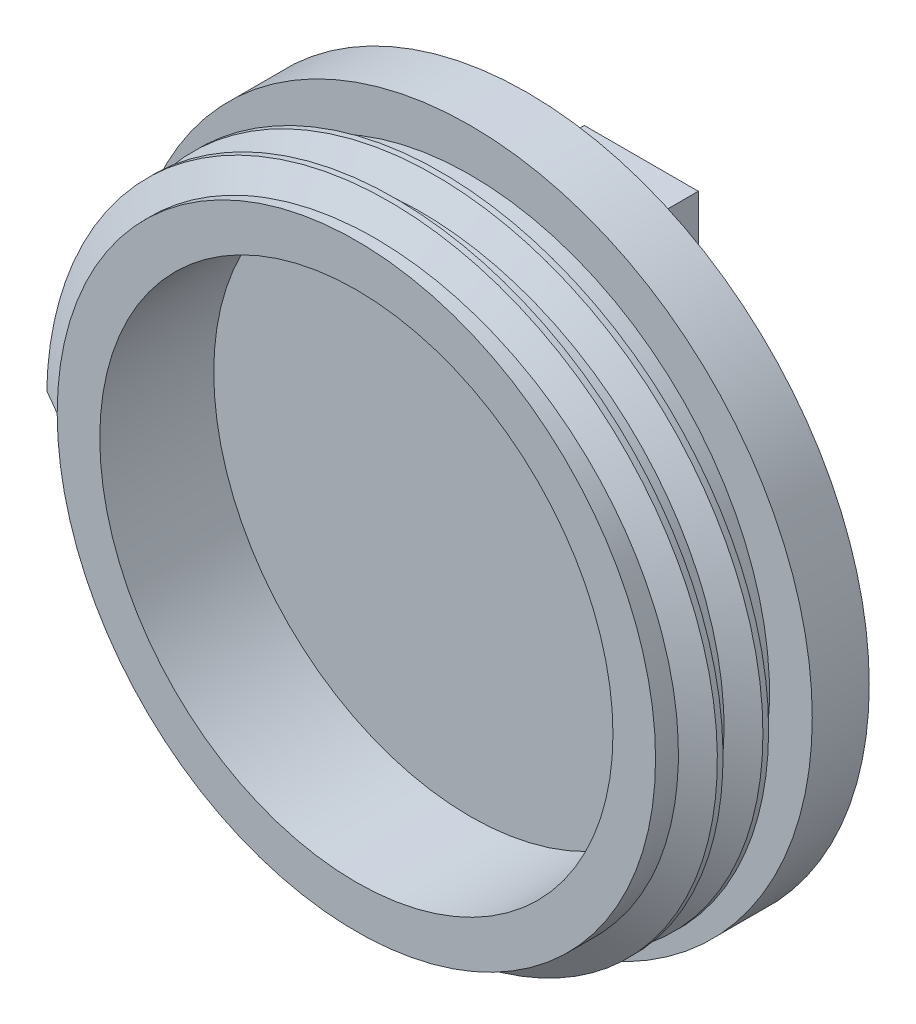
from build123d import *
from build123d.topology import SkipClean

# Parameters (mm, degrees)
SKETCH1_R           = 5.25
BOSS_EXTRUDE1_DEPTH = 2
THREAD1_PITCH       = 0.8
SKETCH4_R           = 6
BOSS_EXTRUDE2_DEPTH = 1
SKETCH5_R           = 4.502613012
CUT_EXTRUDE1_DEPTH  = 4
BOSS_EXTRUDE3_START = -1
SKETCH7_R           = 6
SKETCH7_R_2         = 4.031118497
BOSS_EXTRUDE3_DEPTH = 1
BOSS_EXTRUDE4_START = -1
SKETCH8_R           = 6
BOSS_EXTRUDE4_DEPTH = 1
SKETCH9_W           = 2
SKETCH9_H           = 8
BOSS_EXTRUDE5_DEPTH = 2
FILLET1_START       = -4
FILLET1_DEPTH       = 8
FILLET1_START_2     = -2
FILLET1_2_DEPTH     = 4
FILLET1_START_3     = -6
FILLET1_3_DEPTH     = 12


with BuildPart() as part:
    # Sketch1 → Boss-Extrude1 (new body)
    with BuildSketch(Plane.XY):
        Circle(SKETCH1_R)
    extrude(amount=BOSS_EXTRUDE1_DEPTH)

    # Thread1: arcs per turn and ends read off the stored shape
    # Thread1: the profile of Thread Profile1 profile screwed along a right-hand helix through 1.875 turns, 8 arcs to a turn; built about Z, then put on its axis
    thread1_z = Axis((0, 0, 0), (0, 0, 1))
    thread1_corners = [(5.2497, 0, -0.000173205), (5.6830127, 0, 0.249999999), (5.6830127, 0, 0.349999999), (5.2497, 0, 0.600173203)]
    with BuildLine(mode=Mode.PRIVATE) as thread1_profile:
        Line(thread1_corners[0], thread1_corners[1])
        Line(thread1_corners[1], thread1_corners[2])
        Line(thread1_corners[2], thread1_corners[3])
        Line(thread1_corners[3], thread1_corners[0])
    thread1_cap = Face(thread1_profile.wire())
    thread1_turn_angles = [0, 22.5, 45, 67.5, 90, 112.5, 135, 157.5, 180, 202.5, 225, 247.5, 270, 292.5, 315, 337.5, 360]
    thread1_turn_weights = [1, 0.9238795325112867, 1, 0.9238795325112867, 1, 0.9238795325112867, 1, 0.9238795325112867, 1, 0.9238795325112867, 1, 0.9238795325112867, 1, 0.9238795325112867, 1, 0.9238795325112867, 1]
    thread1_turn_rails = [Edge.make_bspline([Vector(p[0], p[1], 0).rotate(thread1_z, thread1_turn_angles[k]) / thread1_turn_weights[k] + Vector(0, 0, p[2] + THREAD1_PITCH * thread1_turn_angles[k] / 360) for k in range(17)], [0, 0, 0, 1, 1, 2, 2, 3, 3, 4, 4, 5, 5, 6, 6, 7, 7, 8, 8, 8], 2, thread1_turn_weights) for p in thread1_corners]
    thread1_turn_sides = [Face.make_surface_from_curves(thread1_turn_rails[p[0]], thread1_turn_rails[p[1]]) for p in [(0, 1), (1, 2), (2, 3), (3, 0)]]
    thread1_last_angles = [360, 382.5, 405, 427.5, 450, 472.5, 495, 517.5, 540, 562.5, 585, 607.5, 630, 652.5, 675]
    thread1_last_weights = [1, 0.9238795325112867, 1, 0.9238795325112867, 1, 0.9238795325112867, 1, 0.9238795325112867, 1, 0.9238795325112867, 1, 0.9238795325112867, 1, 0.9238795325112867, 1]
    thread1_last_rails = [Edge.make_bspline([Vector(p[0], p[1], 0).rotate(thread1_z, thread1_last_angles[k]) / thread1_last_weights[k] + Vector(0, 0, p[2] + THREAD1_PITCH * thread1_last_angles[k] / 360) for k in range(15)], [0, 0, 0, 1, 1, 2, 2, 3, 3, 4, 4, 5, 5, 6, 6, 7, 7, 7], 2, thread1_last_weights) for p in thread1_corners]
    thread1_last_sides = [Face.make_surface_from_curves(thread1_last_rails[p[0]], thread1_last_rails[p[1]]) for p in [(0, 1), (1, 2), (2, 3), (3, 0)]]
    thread1 = Plane(origin=(0, 0, 2), x_dir=(-1, 0, 0), z_dir=(0, 0, -1)) * Solid(Shell([*thread1_turn_sides, *thread1_last_sides, thread1_cap, thread1_cap.rotate(thread1_z, 675).moved(Location((0, 0, THREAD1_PITCH * 675 / 360)))]))
    add(thread1)

    # Sketch4 → Boss-Extrude2 (add)
    with BuildSketch(Plane(origin=(0, 0, 0), x_dir=(-1, 0, 0), z_dir=(0, 0, -1))):
        Circle(SKETCH4_R)
    extrude(amount=BOSS_EXTRUDE2_DEPTH)

    # Sketch5 → Cut-Extrude1 (cut)
    with SkipClean():  # the faces are left unmerged after this step: merging them gives an invalid solid
        with BuildSketch(Plane.XY.offset(2)):
            Circle(SKETCH5_R)
        extrude(amount=-CUT_EXTRUDE1_DEPTH, mode=Mode.SUBTRACT)

    # Sketch7 → Boss-Extrude3 (add)
    with SkipClean():  # the faces are left unmerged after this step: merging them gives an invalid solid
        with BuildSketch(Plane(origin=(0, 0, -1), x_dir=(-1, 0, 0), z_dir=(0, 0, -1)).offset(BOSS_EXTRUDE3_START)):
            Circle(SKETCH7_R)
            Circle(SKETCH7_R_2, mode=Mode.SUBTRACT)
        extrude(amount=BOSS_EXTRUDE3_DEPTH)

    # Sketch8 → Boss-Extrude4 (add)
    with SkipClean():  # the faces are left unmerged after this step: merging them gives an invalid solid
        with BuildSketch(Plane(origin=(0, 0, -1), x_dir=(-1, 0, 0), z_dir=(0, 0, -1)).offset(BOSS_EXTRUDE4_START)):
            Circle(SKETCH8_R)
        extrude(amount=BOSS_EXTRUDE4_DEPTH)

    # Sketch9 → Boss-Extrude5 (add)
    with SkipClean():  # the faces are left unmerged after this step: merging them gives an invalid solid
        with BuildSketch(Plane(origin=(0, 0, -1), x_dir=(-1, 0, 0), z_dir=(0, 0, -1))):
            Rectangle(SKETCH9_W, SKETCH9_H)
        extrude(amount=BOSS_EXTRUDE5_DEPTH)

    # Fillet1: read off the stored shape, not the designer's step
    # Fillet1 outline → Fillet1 (add)
    with SkipClean():  # the faces are left unmerged after this step: merging them gives an invalid solid
        with BuildSketch(Plane(origin=(0, 0, 0), x_dir=(1, 0, 0), z_dir=(0, 1, 0)).offset(FILLET1_START)):
            with BuildLine():
                Line((1, 1), (2, 1))
                ThreePointArc((2, 1), (1.292893219, 1.292893219), (1, 2))
                Line((1, 2), (1, 1))
            make_face()
            with BuildLine():
                Line((-2, 1), (-1, 1))
                Line((-1, 1), (-1, 2))
                ThreePointArc((-1, 2), (-1.292893219, 1.292893219), (-2, 1))
            make_face()
        extrude(amount=FILLET1_DEPTH)

    # Fillet1 2 outline → Fillet1 2 (add)
    with SkipClean():  # the faces are left unmerged after this step: merging them gives an invalid solid
        with BuildSketch(Plane.YZ.offset(FILLET1_START_2)):
            with BuildLine():
                Line((-4, -2), (-4, -1))
                Line((-4, -1), (-5, -1))
                ThreePointArc((-5, -1), (-4.292893219, -1.292893219), (-4, -2))
            make_face()
            with BuildLine():
                ThreePointArc((4, -2), (4.292893219, -1.292893219), (5, -1))
                Line((5, -1), (4, -1))
                Line((4, -1), (4, -2))
            make_face()
        extrude(amount=FILLET1_2_DEPTH)

    # Fillet1 3 outline → Fillet1 3 (cut)
    with SkipClean():  # the faces are left unmerged after this step: merging them gives an invalid solid
        with BuildSketch(Plane(origin=(0, 0, 0), x_dir=(1, 0, 0), z_dir=(0, 1, 0)).offset(FILLET1_START_3)):
            with BuildLine():
                Line((2, 2), (1, 2))
                ThreePointArc((1, 2), (1.292893219, 1.292893219), (2, 1))
                Line((2, 1), (2, 2))
            make_face()
            with BuildLine():
                Line((-1, 2), (-2, 2))
                Line((-2, 2), (-2, 1))
                ThreePointArc((-2, 1), (-1.292893219, 1.292893219), (-1, 2))
            make_face()
        extrude(amount=FILLET1_3_DEPTH, mode=Mode.SUBTRACT)


solid = part.part
